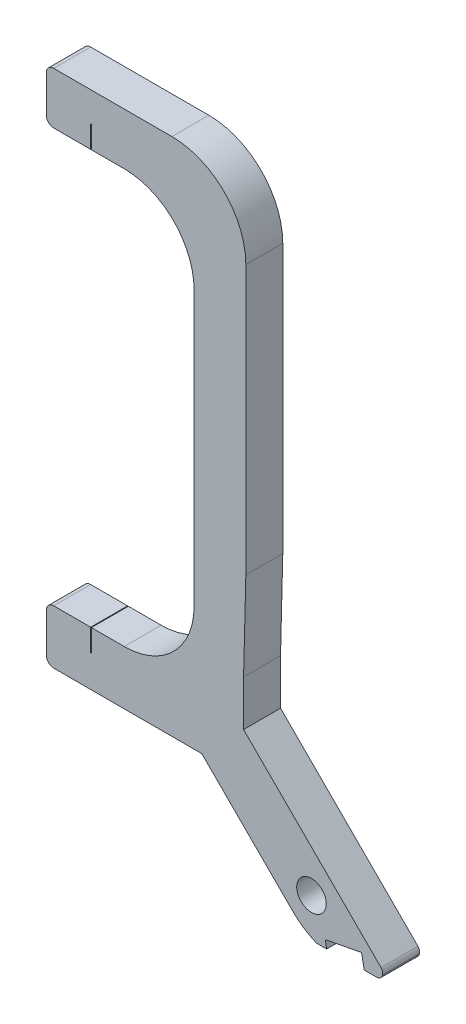
from build123d import *

# Parameters (mm, degrees)
SKETCH1_R           = 2
BOSS_EXTRUDE1_DEPTH = 5
SKETCH2_W           = 0.1
SKETCH2_H           = 5
CUT_EXTRUDE1_DEPTH  = 3
SKETCH3_W           = 0.1
SKETCH3_H           = 5
CUT_EXTRUDE2_DEPTH  = 3
SKETCH5_W           = 5
SKETCH5_H           = 5
CUT_EXTRUDE3_DEPTH  = 3


with BuildPart() as part:
    # Sketch1 → Boss-Extrude1 (new body)
    with BuildSketch(Plane.XY):
        with BuildLine():
            Line((1, 0), (17, 0))
            ThreePointArc((17, 0), (24.071067812, -2.928932188), (27, -10))
            Line((27, -10), (27, -10.164726931))
            Line((27, -10.164726931), (27, -46.377180563))
            Line((27, -46.377180563), (26.694646109, -58.493944172))
            Line((26.694646109, -58.493944172), (26.694646109, -64.399649032))
            Line((26.694646109, -64.399649032), (26.694646109, -64.648499642))
            Line((26.694646109, -64.648499642), (45.291824906, -83.245678439))
            ThreePointArc((45.291824906, -83.245678439), (45.495822693, -83.59321769), (45.504515015, -83.996111065))
            Line((45.504515015, -83.996111065), (45.490365745, -84.055724665))
            ThreePointArc((45.490365745, -84.055724665), (45.211760066, -84.495661458), (44.721403846, -84.670922077))
            Line((44.721403846, -84.670922077), (36.743309345, -84.764807165))
            ThreePointArc((36.743309345, -84.764807165), (36.575585477, -84.749042296), (36.414881636, -84.698504168))
            ThreePointArc((36.414881636, -84.698504168), (34.774424803, -83.79382462), (33.33148975, -82.599051781))
            Line((33.33148975, -82.599051781), (21.037791859, -70.305353891))
            Line((21.037791859, -70.305353891), (16.801941123, -70.305353891))
            Line((16.801941123, -70.305353891), (1, -70.305353891))
            ThreePointArc((1, -70.305353891), (0.292893219, -70.012460672), (0, -69.305353891))
            Line((0, -69.305353891), (0, -64))
            ThreePointArc((0, -64), (0.292893219, -63.292893219), (1, -63))
            Line((1, -63), (10.539737479, -63))
            ThreePointArc((10.539737479, -63), (17.229153259, -60.229153259), (20, -53.539737479))
            Line((20, -53.539737479), (20, -16.460262521))
            ThreePointArc((20, -16.460262521), (17.229153259, -9.770846741), (10.539737479, -7))
            Line((10.539737479, -7), (1, -7))
            ThreePointArc((1, -7), (0.292893219, -6.707106781), (0, -6))
            Line((0, -6), (0, -1))
            ThreePointArc((0, -1), (0.292893219, -0.292893219), (1, 0))
        make_face()
        with Locations((35.887034264, -79.497742046)):
            Circle(SKETCH1_R, mode=Mode.SUBTRACT)
    extrude(amount=BOSS_EXTRUDE1_DEPTH)

    # Sketch2 → Cut-Extrude1 (cut)
    with BuildSketch(Plane(origin=(0, -63, 0), x_dir=(1, 0, 0), z_dir=(0, 1, 0))):
        with Locations((6.05, -2.5)):
            Rectangle(SKETCH2_W, SKETCH2_H)
    extrude(amount=-CUT_EXTRUDE1_DEPTH, mode=Mode.SUBTRACT)

    # Sketch3 → Cut-Extrude2 (cut)
    with BuildSketch(Plane.XZ.offset(7)):
        with Locations((6.05, 2.5)):
            Rectangle(SKETCH3_W, SKETCH3_H)
    extrude(amount=-CUT_EXTRUDE2_DEPTH, mode=Mode.SUBTRACT)

    # Sketch5 → Cut-Extrude3 (cut)
    with BuildSketch(Plane(origin=(17.315374744, -90.697945443, 0), x_dir=(0, 0, -1), z_dir=(0.18752568975643225, -0.9822596986955, 0))):
        with Locations((-2.5, 23.878338891)):
            Rectangle(SKETCH5_W, SKETCH5_H)
    extrude(amount=-CUT_EXTRUDE3_DEPTH, mode=Mode.SUBTRACT)


solid = part.part
